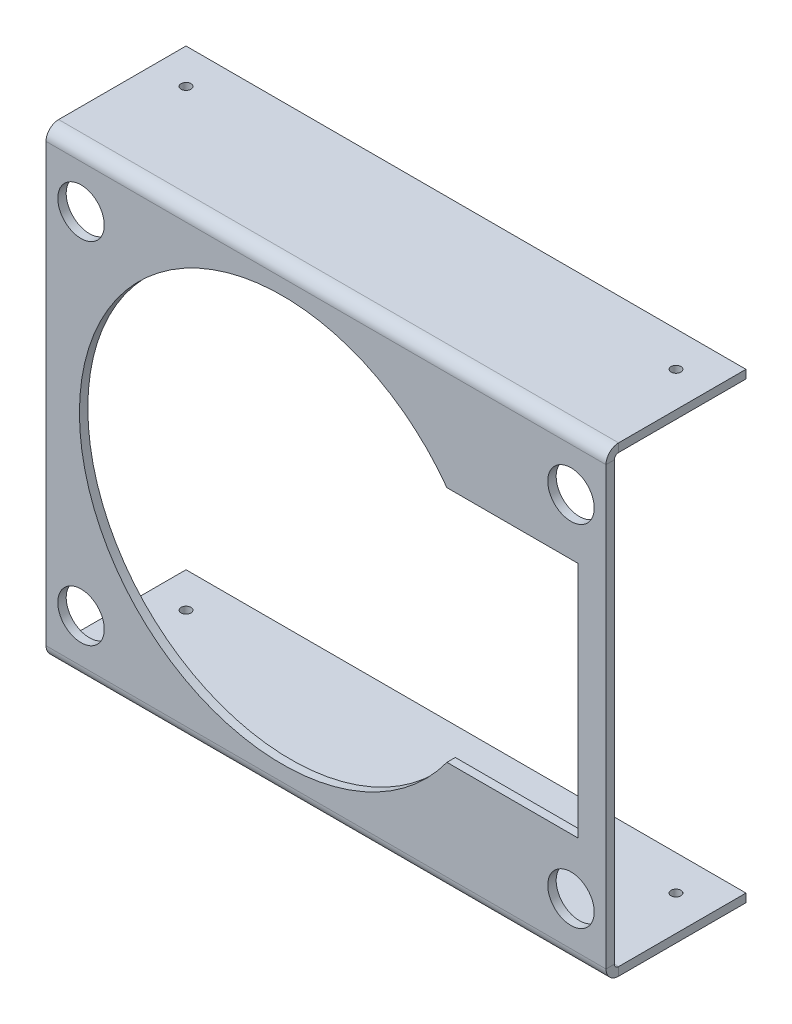
from build123d import *

# Parameters (mm, degrees)
SKETCH1_W                      = 50.8
SKETCH1_H                      = 41.91
BASE_FLANGE1_DEPTH             = 0.762
EDGE_FLANGE1_STRIP_W           = 3.81
EDGE_FLANGE1_STRIP_H           = 0.762
EDGE_FLANGE1_STRIP_CUT_DEPTH   = 50.8
EDGE_FLANGE1_STRIP_2_W         = 3.81
EDGE_FLANGE1_STRIP_2_H         = 0.762
EDGE_FLANGE1_STRIP_CUT_2_DEPTH = 50.8
EDGE_FLANGE1_DEPTH             = 50.8
EDGE_FLANGE1_BEND_DEPTH        = 50.8
SKETCH14_R                     = 18.415
CUT_EXTRUDE1_DEPTH             = 2.54
SKETCH16_R                     = 0.4445
CUT_EXTRUDE4_DEPTH             = 53.848
SKETCH17_R                     = 2.1082
CUT_EXTRUDE5_DEPTH             = 36.025531673
CUT_EXTRUDE6_DEPTH             = 36.025531673


# Sheet-metal steps are written as plain solids
with BuildPart() as part:
    # Sketch1 → Base-Flange1 (new body)
    with BuildSketch(Plane.XY):
        Rectangle(SKETCH1_W, SKETCH1_H)
    extrude(amount=-BASE_FLANGE1_DEPTH)

    # Edge-Flange1 strip (across the edge) → Edge-Flange1 strip cut (cut)
    with BuildSketch(Plane(origin=(-25.4, 20.955, -0.762), x_dir=(0, -1, 0), z_dir=(1, 0, 0))):
        with Locations((-0.762, -0.381)):
            Rectangle(EDGE_FLANGE1_STRIP_W, EDGE_FLANGE1_STRIP_H)
    extrude(amount=EDGE_FLANGE1_STRIP_CUT_DEPTH, mode=Mode.SUBTRACT)

    # Edge-Flange1 strip 2 (across the edge) → Edge-Flange1 strip cut 2 (cut)
    with BuildSketch(Plane(origin=(25.4, -20.955, -0.762), x_dir=(0, 1, 0), z_dir=(-1, 0, 0))):
        with Locations((-0.762, -0.381)):
            Rectangle(EDGE_FLANGE1_STRIP_2_W, EDGE_FLANGE1_STRIP_2_H)
    extrude(amount=EDGE_FLANGE1_STRIP_CUT_2_DEPTH, mode=Mode.SUBTRACT)

    # Edge-Flange1 section (across the edge) → Edge-Flange1 (add)
    with BuildSketch(Plane(origin=(-25.4, 20.955, -0.762), x_dir=(0, -1, 0), z_dir=(1, 0, 0))):
        with BuildLine():
            Line((0, 0.381), (0, 11.938))
            Line((0, 11.938), (0.762, 11.938))
            Line((0.762, 11.938), (0.762, 0.381))
            ThreePointArc((0.762, 0.381), (0.873592316, 0.111592316), (1.143, 0))
            Line((1.143, 0), (1.143, -0.762))
            ThreePointArc((1.143, -0.762), (0.334776949, -0.427223051), (0, 0.381))
        make_face()
    extrude(amount=EDGE_FLANGE1_DEPTH)

    # Edge-Flange1 section 2 (across the edge) → Edge-Flange1 bend (add)
    with BuildSketch(Plane(origin=(25.4, -20.955, -0.762), x_dir=(0, 1, 0), z_dir=(-1, 0, 0))):
        with BuildLine():
            Line((0, 0.381), (0, 11.938))
            Line((0, 11.938), (0.762, 11.938))
            Line((0.762, 11.938), (0.762, 0.381))
            ThreePointArc((0.762, 0.381), (0.873592316, 0.111592316), (1.143, 0))
            Line((1.143, 0), (1.143, -0.762))
            ThreePointArc((1.143, -0.762), (0.334776949, -0.427223051), (0, 0.381))
        make_face()
    extrude(amount=EDGE_FLANGE1_BEND_DEPTH)

    # Sketch14 → Cut-Extrude1 (cut)
    with BuildSketch(Plane.XY.offset(0.889)):
        with Locations(Location((-3.954996568, 0, 0), (0, 0, 180))):
            Circle(SKETCH14_R)
    extrude(amount=-CUT_EXTRUDE1_DEPTH, mode=Mode.SUBTRACT)

    # Sketch16 → Cut-Extrude4 (cut)
    with BuildSketch(Plane(origin=(0, 20.955, 0), x_dir=(1, 0, 0), z_dir=(0, 1, 0))):
        with Locations(Location((22.225, 9.525, 0), (0, 0, 270))):
            Circle(SKETCH16_R)
        with Locations(Location((-22.225, 9.525, 0), (0, 0, 270))):
            Circle(SKETCH16_R)
    extrude(amount=-CUT_EXTRUDE4_DEPTH, mode=Mode.SUBTRACT)

    # Sketch17 → Cut-Extrude5 (cut, through all)
    with BuildSketch(Plane(origin=(0, 0, -0.762), x_dir=(-1, 0, 0), z_dir=(0, 0, -1))):
        with Locations((-22.225, 15.875)):
            Circle(SKETCH17_R)
        with Locations((-22.225, -15.875)):
            Circle(SKETCH17_R)
        with Locations((22.225, -15.875)):
            Circle(SKETCH17_R)
        with Locations((22.225, 15.875)):
            Circle(SKETCH17_R)
    extrude(amount=-CUT_EXTRUDE5_DEPTH, mode=Mode.SUBTRACT)

    # Sketch18 → Cut-Extrude6 (cut, through all)
    with BuildSketch(Plane(origin=(0, 0, -0.762), x_dir=(-1, 0, 0), z_dir=(0, 0, -1))):
        with BuildLine():
            Line((-10.968730797, 10.788632283), (-22.86, 10.788632283))
            Line((-22.86, 10.788632283), (-22.86, -10.788632283))
            Line((-22.86, -10.788632283), (-10.968730797, -10.788632283))
            ThreePointArc((-10.968730797, -10.788632283), (-14.460003432, 0), (-10.968730797, 10.788632283))
        make_face()
    extrude(amount=-CUT_EXTRUDE6_DEPTH, mode=Mode.SUBTRACT)


solid = part.part
